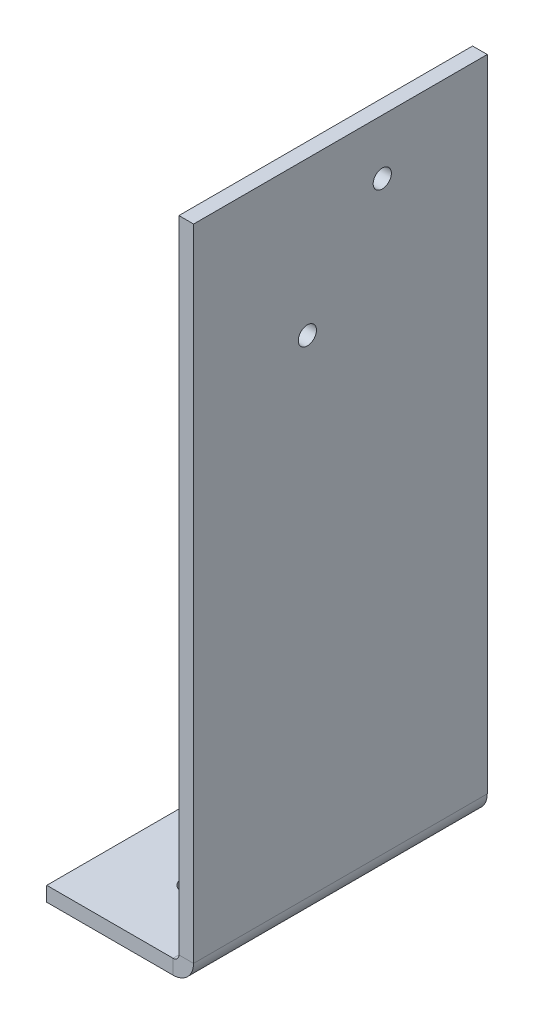
from build123d import *

# Parameters (mm, degrees)
SKETCH2_W                    = 25.4
SKETCH2_H                    = 50.8
BASE_FLANGE1_DEPTH           = 2.54
EDGE_FLANGE1_STRIP_W         = 12.16
EDGE_FLANGE1_STRIP_H         = 2.54
EDGE_FLANGE1_STRIP_CUT_DEPTH = 50.8
EDGE_FLANGE1_DEPTH           = 50.8
SKETCH10_R                   = 2.032
CUT_EXTRUDE1_DEPTH           = 128.633420388
SKETCH11_R                   = 1.5748
CUT_EXTRUDE2_DEPTH           = 125.874005301


# Sheet-metal steps are written as plain solids
with BuildPart() as part:
    # Sketch2 → Base-Flange1 (new body)
    with BuildSketch(Plane(origin=(0, 0, 0), x_dir=(1, 0, 0), z_dir=(0, 1, 0))):
        with Locations((12.7, 25.4)):
            Rectangle(SKETCH2_W, SKETCH2_H)
    extrude(amount=-BASE_FLANGE1_DEPTH)

    # Edge-Flange1 strip (across the edge) → Edge-Flange1 strip cut (cut)
    with BuildSketch(Plane(origin=(25.4, 0, 0), x_dir=(-1, 0, 0), z_dir=(0, 0, -1))):
        with Locations((-2.54, -1.27)):
            Rectangle(EDGE_FLANGE1_STRIP_W, EDGE_FLANGE1_STRIP_H)
    extrude(amount=EDGE_FLANGE1_STRIP_CUT_DEPTH, mode=Mode.SUBTRACT)

    # Edge-Flange1 section (across the edge) → Edge-Flange1 (add)
    with BuildSketch(Plane(origin=(25.4, 0, 0), x_dir=(-1, 0, 0), z_dir=(0, 0, -1))):
        with BuildLine():
            Line((0, 1), (0, 111.76))
            Line((0, 111.76), (2.54, 111.76))
            Line((2.54, 111.76), (2.54, 1))
            ThreePointArc((2.54, 1), (2.832893219, 0.292893219), (3.54, 0))
            Line((3.54, 0), (3.54, -2.54))
            ThreePointArc((3.54, -2.54), (1.036841995, -1.503158005), (0, 1))
        make_face()
    extrude(amount=EDGE_FLANGE1_DEPTH)

    # Sketch10 → Cut-Extrude1 (cut, through all)
    with BuildSketch(Plane.XZ.offset(2.54)):
        with Locations(Location((12.7, -38.1, 0), (0, 0, 270))):
            Circle(SKETCH10_R)
        with Locations(Location((12.7, -12.7, 0), (0, 0, 270))):
            Circle(SKETCH10_R)
    extrude(amount=-CUT_EXTRUDE1_DEPTH, mode=Mode.SUBTRACT)

    # Sketch11 → Cut-Extrude2 (cut, through all)
    with BuildSketch(Plane.ZY.offset(-22.86)):
        with Locations(Location((-32.639, 102.2604, 0), (0, 0, 270))):
            Circle(SKETCH11_R)
        with Locations(Location((-19.685, 85.2424, 0), (0, 0, 270))):
            Circle(SKETCH11_R)
    extrude(amount=-CUT_EXTRUDE2_DEPTH, mode=Mode.SUBTRACT)


solid = part.part
